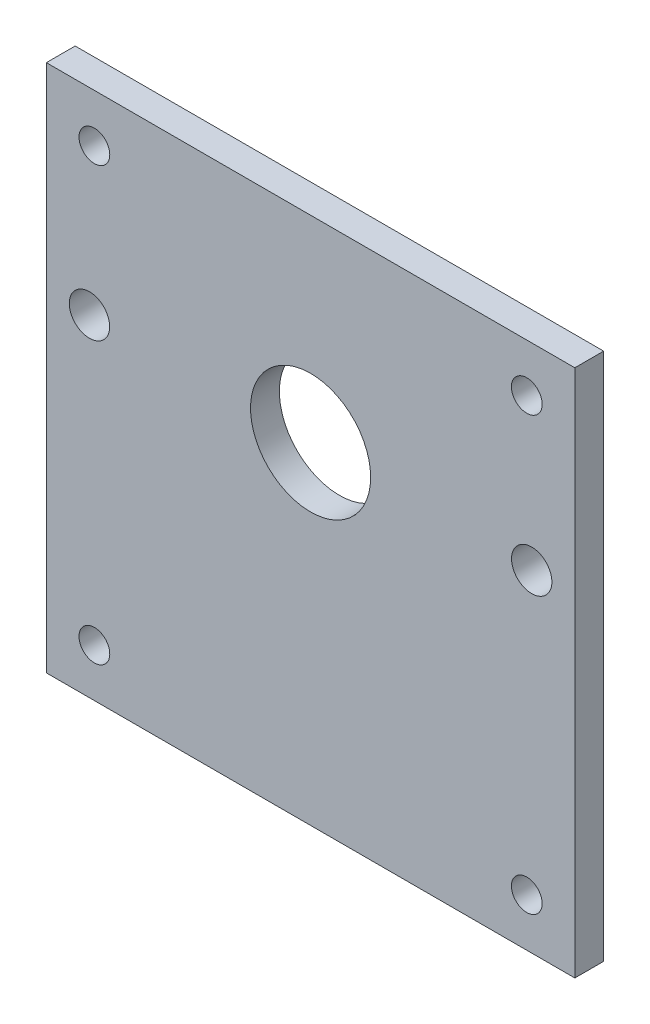
from build123d import *

# Parameters (mm, degrees)
SKETCH_1_W      = 55
SKETCH_1_H      = 55
SKETCH_1_R      = 6.25
SKETCH_1_R_2    = 1.6
SKETCH_1_R_3    = 2.1
EXTRUDE_1_DEPTH = 3


with BuildPart() as part:
    # ｽｹｯﾁ1 → ﾎﾞｽ - 押し出し1 (new body)
    with BuildSketch(Plane.XY):
        Rectangle(SKETCH_1_W, SKETCH_1_H)
        with Locations((0, 7)):
            Circle(SKETCH_1_R, mode=Mode.SUBTRACT)
        with Locations((-22.5, 22.5)):
            Circle(SKETCH_1_R_2, mode=Mode.SUBTRACT)
        with Locations((22.5, 22.5)):
            Circle(SKETCH_1_R_2, mode=Mode.SUBTRACT)
        with Locations((-22.5, -22.5)):
            Circle(SKETCH_1_R_2, mode=Mode.SUBTRACT)
        with Locations((22.5, -22.5)):
            Circle(SKETCH_1_R_2, mode=Mode.SUBTRACT)
        with Locations((-23.0125, 7)):
            Circle(SKETCH_1_R_3, mode=Mode.SUBTRACT)
        with Locations((23.0125, 7)):
            Circle(SKETCH_1_R_3, mode=Mode.SUBTRACT)
    extrude(amount=EXTRUDE_1_DEPTH)


solid = part.part
